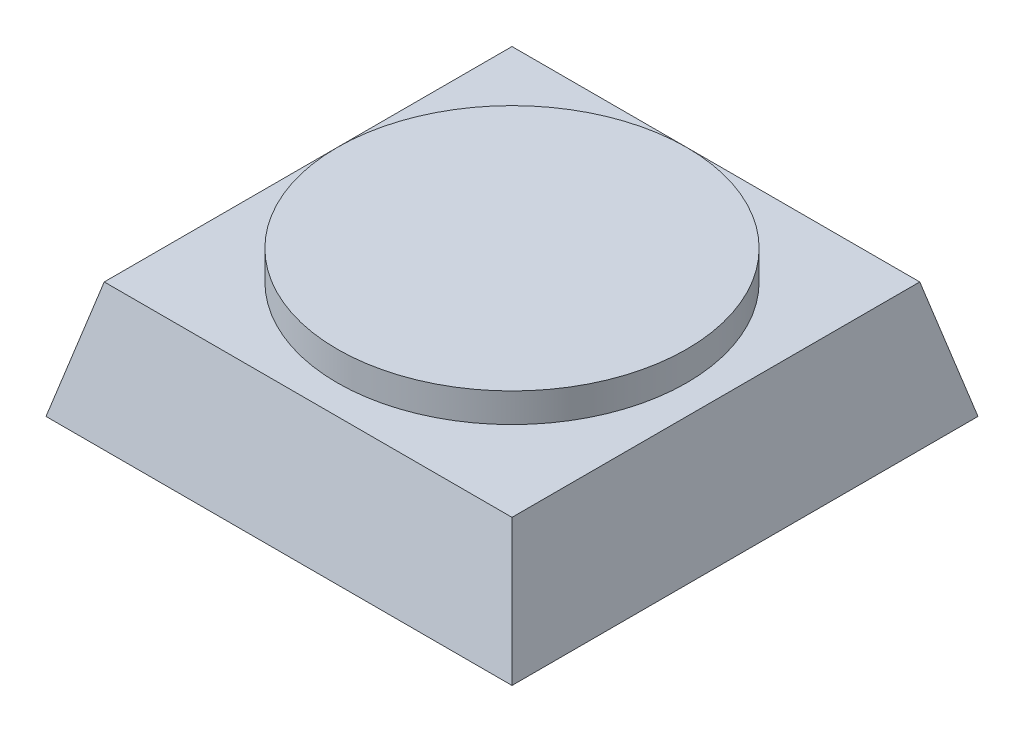
from build123d import *
from OCP.BRepFilletAPI import BRepFilletAPI_MakeChamfer

# Parameters (mm, degrees)
SKETCH_1_W       = 80
SKETCH_1_H       = 80
EXTRUDE_1_DEPTH  = 20
SKETCH_2_R       = 30
EXTRUDE_2_DEPTH  = 5
CHAMFER_1_SIZE   = 20
CHAMFER_1_SIZE_2 = 5


with BuildPart() as part:
    # Эскиз1 → Бобышка-Вытянуть1 (new body)
    with BuildSketch(Plane(origin=(0, 0, 0), x_dir=(1, 0, 0), z_dir=(0, 1, 0))):
        Rectangle(SKETCH_1_W, SKETCH_1_H)
    extrude(amount=EXTRUDE_1_DEPTH)

    # Эскиз2 → Бобышка-Вытянуть2 (add)
    with BuildSketch(Plane(origin=(0, 20, 0), x_dir=(1, 0, 0), z_dir=(0, 1, 0))):
        with Locations(Location((0, 0, 0), (0, 0, 270))):
            Circle(SKETCH_2_R)
    extrude(amount=EXTRUDE_2_DEPTH)

    # Фаска1
    chamfer_1_edges_1 = [part.edges().sort_by_distance(p)[0] for p in [
        (40, 20, 0),
    ]]
    chamfer_1_side_1 = [part.faces().sort_by_distance(p)[0] for p in [
        (40, 19.9, 0),
    ]]
    chamfer_1_edges_2 = [part.edges().sort_by_distance(p)[0] for p in [
        (0, 20, -40),
    ]]
    chamfer_1_side_2 = [part.faces().sort_by_distance(p)[0] for p in [
        (0, 20, -39.9),
    ]]
    chamfer_1_edges_3 = [part.edges().sort_by_distance(p)[0] for p in [
        (-40, 20, 0),
    ]]
    chamfer_1_side_3 = [part.faces().sort_by_distance(p)[0] for p in [
        (-40, 19.9, 0),
    ]]
    chamfer_1_edges_4 = [part.edges().sort_by_distance(p)[0] for p in [
        (0, 20, 40),
    ]]
    chamfer_1_side_4 = [part.faces().sort_by_distance(p)[0] for p in [
        (0, 19.9, 40),
    ]]
    chamfer_1 = BRepFilletAPI_MakeChamfer(part.part.solid().wrapped)
    for e in chamfer_1_edges_1:
        chamfer_1.Add(CHAMFER_1_SIZE - 0.0001, CHAMFER_1_SIZE_2 - 0.0001, e.wrapped, chamfer_1_side_1[0].wrapped)
    for e in chamfer_1_edges_2:
        chamfer_1.Add(CHAMFER_1_SIZE_2 - 0.0001, CHAMFER_1_SIZE - 0.0001, e.wrapped, chamfer_1_side_2[0].wrapped)
    for e in chamfer_1_edges_3:
        chamfer_1.Add(CHAMFER_1_SIZE - 0.0001, CHAMFER_1_SIZE_2 - 0.0001, e.wrapped, chamfer_1_side_3[0].wrapped)
    for e in chamfer_1_edges_4:
        chamfer_1.Add(CHAMFER_1_SIZE - 0.0001, CHAMFER_1_SIZE_2 - 0.0001, e.wrapped, chamfer_1_side_4[0].wrapped)
    add(Compound.cast(chamfer_1.Shape()), mode=Mode.REPLACE)  # a hair under: the kernel refuses the full size


solid = part.part
